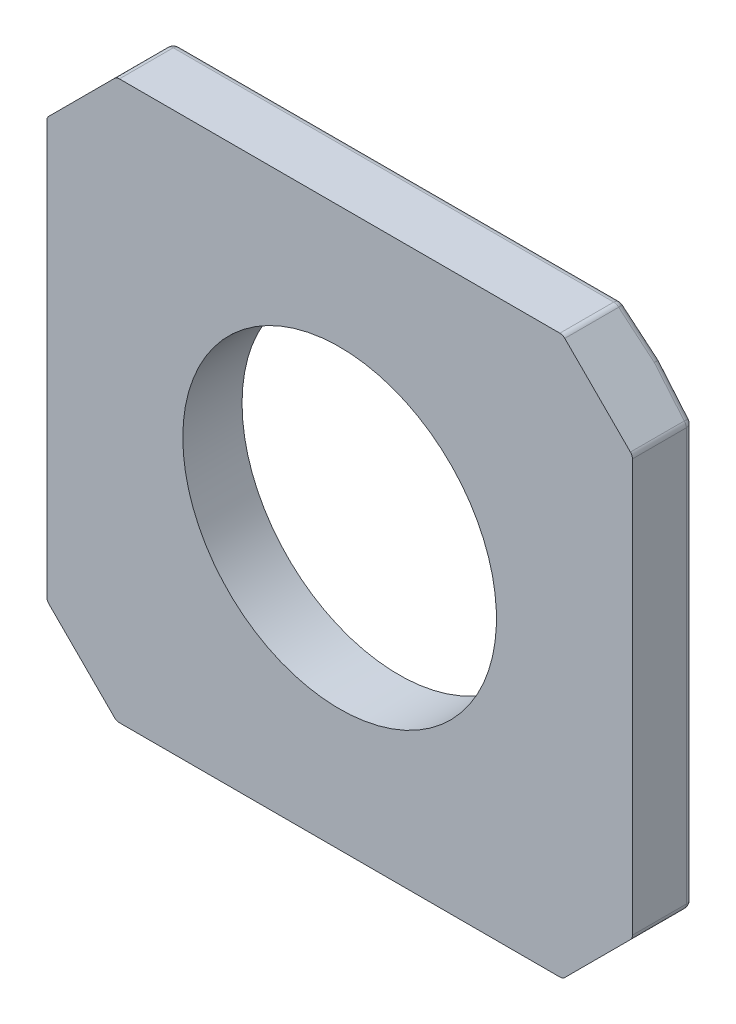
from build123d import *

# Parameters (mm, degrees)
SKETCH1_W             = 168.04206526
SKETCH1_H             = 160
BOSS_EXTRUDE1_DEPTH   = 3
SKETCH3_R             = 45
BOSS_EXTRUDE4_DEPTH   = 5
CHAMFER1_SIZE         = 2.712148569
CHAMFER1_SIZE_2       = 31
SKETCH4_R             = 1.7
SKETCH4_R_2           = 1.683576216
CUT_EXTRUDE1_DEPTH    = 52
BOSS_EXTRUDE5_START   = 30
SKETCH5_W             = 168.04206526
SKETCH5_H             = 160
SKETCH5_R             = 45
BOSS_EXTRUDE5_DEPTH   = 30
CHAMFER2_SIZE         = 20
FILLET1_R             = 2
BOSS_EXTRUDE6_DEPTH   = 2
SKETCH6_W             = 2.066213129
SKETCH6_H             = 1.103220701
BOSS_EXTRUDE6_2_DEPTH = 2
BOSS_EXTRUDE6_3_DEPTH = 2
BOSS_EXTRUDE6_4_DEPTH = 2
BOSS_EXTRUDE6_5_DEPTH = 2
BOSS_EXTRUDE6_6_DEPTH = 2
BODY_MOVE_COPY1_ANGLE = 90
SKETCH8_R             = 1.7
CUT_EXTRUDE2_DEPTH    = 6
CUT_EXTRUDE3_DEPTH    = 13


with BuildPart() as part:
    # Sketch1 → Boss-Extrude1 (new body)
    with BuildSketch(Plane.XY):
        Rectangle(SKETCH1_W, SKETCH1_H)
        with BuildLine():
            ThreePointArc((13.58448221, 59.23734015), (-30.3875, 52.632693915), (-58.093282528, 17.854163384))
            ThreePointArc((-58.093282528, 17.854163384), (-58.904146387, 16.297210956), (-60.216127019, 15.13088858))
            Line((-60.216127019, 15.13088858), (-64.649261274, 12.445040222))
            ThreePointArc((-64.649261274, 12.445040222), (-66.295367611, 10.852102238), (-67.087867714, 8.702902135))
            ThreePointArc((-67.087867714, 8.702902135), (-67.65, 0), (-67.087867714, -8.702902135))
            ThreePointArc((-67.087867714, -8.702902135), (-66.295367611, -10.852102238), (-64.649261274, -12.445040222))
            Line((-64.649261274, -12.445040222), (-60.216127019, -15.13088858))
            ThreePointArc((-60.216127019, -15.13088858), (-58.904146387, -16.297210956), (-58.093282528, -17.854163384))
            ThreePointArc((-58.093282528, -17.854163384), (-30.3875, -52.632693915), (13.58448221, -59.23734015))
            ThreePointArc((13.58448221, -59.23734015), (15.338274495, -59.161092638), (17.004329617, -59.714140006))
            Line((17.004329617, -59.714140006), (21.546909654, -62.21042271))
            ThreePointArc((21.546909654, -62.21042271), (23.749487583, -62.839523623), (26.006999521, -62.451248794))
            ThreePointArc((26.006999521, -62.451248794), (33.825, -58.586618566), (41.080868193, -53.748346658))
            ThreePointArc((41.080868193, -53.748346658), (42.545880028, -51.987421385), (43.10235162, -49.765382488))
            Line((43.10235162, -49.765382488), (43.211797402, -44.583251426))
            ThreePointArc((43.211797402, -44.583251426), (43.565871892, -42.863881682), (44.508800318, -41.383176766))
            ThreePointArc((44.508800318, -41.383176766), (60.775, 0), (44.508800318, 41.383176766))
            ThreePointArc((44.508800318, 41.383176766), (43.565871892, 42.863881682), (43.211797402, 44.583251426))
            Line((43.211797402, 44.583251426), (43.10235162, 49.765382488))
            ThreePointArc((43.10235162, 49.765382488), (42.545880028, 51.987421385), (41.080868193, 53.748346658))
            ThreePointArc((41.080868193, 53.748346658), (33.825, 58.586618566), (26.006999521, 62.451248794))
            ThreePointArc((26.006999521, 62.451248794), (23.749487583, 62.839523623), (21.546909654, 62.21042271))
            Line((21.546909654, 62.21042271), (17.004329617, 59.714140006))
            ThreePointArc((17.004329617, 59.714140006), (15.338274495, 59.161092638), (13.58448221, 59.23734015))
        make_face(mode=Mode.SUBTRACT)
    extrude(amount=-BOSS_EXTRUDE1_DEPTH)

    # Chamfer1
    # the kernel refuses this chamfer: 31, 2.712148569 mm, written as the material it takes off along each edge
    with BuildSketch(Plane(origin=(-164.609689105, 80, -3), x_dir=(0, 0.40120984275090354, 0.9159861691531129), z_dir=(1, 0, 0)), Plane(origin=(164.609689105, -80, -3), x_dir=(0, -0.40120984275090354, 0.9159861691531129), z_dir=(-1, 0, 0))) as chamfer1_piece_1:
        Polygon((CHAMFER1_SIZE * 0.915986169256, CHAMFER1_SIZE * 0.401209842796), (-CHAMFER1_SIZE_2 * 0.401209842751, CHAMFER1_SIZE_2 * 0.915986169153), (0, 0), align=None)
    extrude(amount=329.21937821, mode=Mode.SUBTRACT)
    with BuildSketch(Plane(origin=(84.02103263, 160.588656475, -3), x_dir=(0.40120984275090354, 0, 0.9159861691531129), z_dir=(0, -1, 0)), Plane(origin=(-84.02103263, -160.588656475, -3), x_dir=(-0.40120984275090354, 0, 0.9159861691531129), z_dir=(0, 1, 0))) as chamfer1_piece_2:
        Polygon((CHAMFER1_SIZE * 0.915986169256, CHAMFER1_SIZE * 0.401209842796), (-CHAMFER1_SIZE_2 * 0.401209842751, CHAMFER1_SIZE_2 * 0.915986169153), (0, 0), align=None)
    extrude(amount=321.17731295, mode=Mode.SUBTRACT)



with BuildPart() as body_2:
    # Sketch3 → Boss-Extrude4 (new body)
    with BuildSketch(Plane.XY):
        with BuildLine():
            ThreePointArc((-58.093282528, 17.854163384), (-30.3875, 52.632693915), (13.58448221, 59.23734015))
            ThreePointArc((13.58448221, 59.23734015), (15.338274495, 59.161092638), (17.004329617, 59.714140006))
            Line((17.004329617, 59.714140006), (21.546909654, 62.21042271))
            ThreePointArc((21.546909654, 62.21042271), (23.749487583, 62.839523623), (26.006999521, 62.451248794))
            ThreePointArc((26.006999521, 62.451248794), (33.825, 58.586618566), (41.080868193, 53.748346658))
            ThreePointArc((41.080868193, 53.748346658), (42.545880028, 51.987421385), (43.10235162, 49.765382488))
            Line((43.10235162, 49.765382488), (43.211797402, 44.583251426))
            ThreePointArc((43.211797402, 44.583251426), (43.565871892, 42.863881682), (44.508800318, 41.383176766))
            ThreePointArc((44.508800318, 41.383176766), (60.775, 0), (44.508800318, -41.383176766))
            ThreePointArc((44.508800318, -41.383176766), (43.565871892, -42.863881682), (43.211797402, -44.583251426))
            Line((43.211797402, -44.583251426), (43.10235162, -49.765382488))
            ThreePointArc((43.10235162, -49.765382488), (42.545880028, -51.987421385), (41.080868193, -53.748346658))
            ThreePointArc((41.080868193, -53.748346658), (33.825, -58.586618566), (26.006999521, -62.451248794))
            ThreePointArc((26.006999521, -62.451248794), (23.749487583, -62.839523623), (21.546909654, -62.21042271))
            Line((21.546909654, -62.21042271), (17.004329617, -59.714140006))
            ThreePointArc((17.004329617, -59.714140006), (15.338274495, -59.161092638), (13.58448221, -59.23734015))
            ThreePointArc((13.58448221, -59.23734015), (-30.3875, -52.632693915), (-58.093282528, -17.854163384))
            ThreePointArc((-58.093282528, -17.854163384), (-58.904146387, -16.297210956), (-60.216127019, -15.13088858))
            Line((-60.216127019, -15.13088858), (-64.649261274, -12.445040222))
            ThreePointArc((-64.649261274, -12.445040222), (-66.295367611, -10.852102238), (-67.087867714, -8.702902135))
            ThreePointArc((-67.087867714, -8.702902135), (-67.65, 0), (-67.087867714, 8.702902135))
            ThreePointArc((-67.087867714, 8.702902135), (-66.295367611, 10.852102238), (-64.649261274, 12.445040222))
            Line((-64.649261274, 12.445040222), (-60.216127019, 15.13088858))
            ThreePointArc((-60.216127019, 15.13088858), (-58.904146387, 16.297210956), (-58.093282528, 17.854163384))
        make_face()
        Circle(SKETCH3_R, mode=Mode.SUBTRACT)
    extrude(amount=BOSS_EXTRUDE4_DEPTH)

    # Sketch4 → Cut-Extrude1 (cut)
    with BuildSketch(Plane(origin=(0, 0, -4), x_dir=(-1, 0, 0), z_dir=(0, 0, -1))):
        with Locations(Location((42, 35, 0), (0, 0, 180))):
            Circle(SKETCH4_R)
        with Locations(Location((42, -35, 0), (0, 0, 180))):
            Circle(SKETCH4_R)
        with Locations(Location((-42, -35, 0), (0, 0, 180))):
            Circle(SKETCH4_R_2)
        with Locations(Location((-42, 35, 0), (0, 0, 180))):
            Circle(SKETCH4_R)
    extrude(amount=-CUT_EXTRUDE1_DEPTH, mode=Mode.SUBTRACT)


with BuildPart() as part_1:
    add(part.part)

    add(body_2.part)  # Boss-Extrude5 merges body 2
    # Sketch5 → Boss-Extrude5 (add)
    # profile 1 of 2: a face of its own
    with BuildSketch(Plane.XY.offset(BOSS_EXTRUDE5_START)):
        Rectangle(SKETCH5_W, SKETCH5_H)
        with BuildLine():
            ThreePointArc((-60.216127019, 15.13088858), (-58.904146387, 16.297210956), (-58.093282528, 17.854163384))
            ThreePointArc((-58.093282528, 17.854163384), (-30.3875, 52.632693915), (13.58448221, 59.23734015))
            ThreePointArc((13.58448221, 59.23734015), (15.338274495, 59.161092638), (17.004329617, 59.714140006))
            Line((17.004329617, 59.714140006), (21.546909654, 62.21042271))
            ThreePointArc((21.546909654, 62.21042271), (23.749487583, 62.839523623), (26.006999521, 62.451248794))
            ThreePointArc((26.006999521, 62.451248794), (33.825, 58.586618566), (41.080868193, 53.748346658))
            ThreePointArc((41.080868193, 53.748346658), (42.545880028, 51.987421385), (43.10235162, 49.765382488))
            Line((43.10235162, 49.765382488), (43.211797402, 44.583251426))
            ThreePointArc((43.211797402, 44.583251426), (43.565871892, 42.863881682), (44.508800318, 41.383176766))
            ThreePointArc((44.508800318, 41.383176766), (60.775, 0), (44.508800318, -41.383176766))
            ThreePointArc((44.508800318, -41.383176766), (43.565871892, -42.863881682), (43.211797402, -44.583251426))
            Line((43.211797402, -44.583251426), (43.10235162, -49.765382488))
            ThreePointArc((43.10235162, -49.765382488), (42.545880028, -51.987421385), (41.080868193, -53.748346658))
            ThreePointArc((41.080868193, -53.748346658), (33.825, -58.586618566), (26.006999521, -62.451248794))
            ThreePointArc((26.006999521, -62.451248794), (23.749487583, -62.839523623), (21.546909654, -62.21042271))
            Line((21.546909654, -62.21042271), (17.004329617, -59.714140006))
            ThreePointArc((17.004329617, -59.714140006), (15.338274495, -59.161092638), (13.58448221, -59.23734015))
            ThreePointArc((13.58448221, -59.23734015), (-30.3875, -52.632693915), (-58.093282528, -17.854163384))
            ThreePointArc((-58.093282528, -17.854163384), (-58.904146387, -16.297210956), (-60.216127019, -15.13088858))
            Line((-60.216127019, -15.13088858), (-64.649261274, -12.445040222))
            ThreePointArc((-64.649261274, -12.445040222), (-66.295367611, -10.852102238), (-67.087867714, -8.702902135))
            ThreePointArc((-67.087867714, -8.702902135), (-67.65, 0), (-67.087867714, 8.702902135))
            ThreePointArc((-67.087867714, 8.702902135), (-66.295367611, 10.852102238), (-64.649261274, 12.445040222))
            Line((-64.649261274, 12.445040222), (-60.216127019, 15.13088858))
        make_face(mode=Mode.SUBTRACT)
    # profile 2 of 2: a face of its own
    with BuildSketch(Plane.XY.offset(BOSS_EXTRUDE5_START)):
        with BuildLine():
            ThreePointArc((-58.093282528, 17.854163384), (-30.3875, 52.632693915), (13.58448221, 59.23734015))
            ThreePointArc((13.58448221, 59.23734015), (15.338274495, 59.161092638), (17.004329617, 59.714140006))
            Line((17.004329617, 59.714140006), (21.546909654, 62.21042271))
            ThreePointArc((21.546909654, 62.21042271), (23.749487583, 62.839523623), (26.006999521, 62.451248794))
            ThreePointArc((26.006999521, 62.451248794), (33.825, 58.586618566), (41.080868193, 53.748346658))
            ThreePointArc((41.080868193, 53.748346658), (42.545880028, 51.987421385), (43.10235162, 49.765382488))
            Line((43.10235162, 49.765382488), (43.211797402, 44.583251426))
            ThreePointArc((43.211797402, 44.583251426), (43.565871892, 42.863881682), (44.508800318, 41.383176766))
            ThreePointArc((44.508800318, 41.383176766), (60.775, 0), (44.508800318, -41.383176766))
            ThreePointArc((44.508800318, -41.383176766), (43.565871892, -42.863881682), (43.211797402, -44.583251426))
            Line((43.211797402, -44.583251426), (43.10235162, -49.765382488))
            ThreePointArc((43.10235162, -49.765382488), (42.545880028, -51.987421385), (41.080868193, -53.748346658))
            ThreePointArc((41.080868193, -53.748346658), (33.825, -58.586618566), (26.006999521, -62.451248794))
            ThreePointArc((26.006999521, -62.451248794), (23.749487583, -62.839523623), (21.546909654, -62.21042271))
            Line((21.546909654, -62.21042271), (17.004329617, -59.714140006))
            ThreePointArc((17.004329617, -59.714140006), (15.338274495, -59.161092638), (13.58448221, -59.23734015))
            ThreePointArc((13.58448221, -59.23734015), (-30.3875, -52.632693915), (-58.093282528, -17.854163384))
            ThreePointArc((-58.093282528, -17.854163384), (-58.904146387, -16.297210956), (-60.216127019, -15.13088858))
            Line((-60.216127019, -15.13088858), (-64.649261274, -12.445040222))
            ThreePointArc((-64.649261274, -12.445040222), (-66.295367611, -10.852102238), (-67.087867714, -8.702902135))
            ThreePointArc((-67.087867714, -8.702902135), (-67.65, 0), (-67.087867714, 8.702902135))
            ThreePointArc((-67.087867714, 8.702902135), (-66.295367611, 10.852102238), (-64.649261274, 12.445040222))
            Line((-64.649261274, 12.445040222), (-60.216127019, 15.13088858))
            ThreePointArc((-60.216127019, 15.13088858), (-58.904146387, 16.297210956), (-58.093282528, 17.854163384))
        make_face()
        Circle(SKETCH5_R, mode=Mode.SUBTRACT)
    extrude(amount=-BOSS_EXTRUDE5_DEPTH)

    # Chamfer2
    chamfer2_edges = [part_1.edges().sort_by_distance(p)[0] for p in [
        (84.02103263, 80, 14.856074285),
        (-84.02103263, 80, 14.856074285),
        (84.02103263, -80, 14.856074285),
        (-84.02103263, -80, 14.856074285),
    ]]
    chamfer(chamfer2_edges, length=CHAMFER2_SIZE)

    # Fillet1
    fillet1_edges = [part_1.edges().sort_by_distance(p)[0] for p in [
        (-84.02103263, 0, -0.287851431),
        (-84.02103263, 60, 14.856074285),
        (-84.02103263, -60, 14.856074285),
        (0, -80, -0.287851431),
        (64.02103263, -80, 14.856074285),
        (-64.02103263, -80, 14.856074285),
        (69.02103263, -75, -0.725294748),
        (-69.02103263, -75, -0.725294748),
        (-79.02103263, 65, -0.725294748),
        (-79.02103263, -65, -0.725294748),
        (0, 80, -0.287851431),
        (64.02103263, 80, 14.856074285),
        (-64.02103263, 80, 14.856074285),
        (69.02103263, 75, -0.725294748),
        (-69.02103263, 75, -0.725294748),
        (84.02103263, 0, -0.287851431),
        (84.02103263, 60, 14.856074285),
        (84.02103263, -60, 14.856074285),
        (79.02103263, 65, -0.725294748),
        (79.02103263, -65, -0.725294748),
    ]]
    fillet(fillet1_edges, radius=FILLET1_R)

    # Sketch8 → Cut-Extrude2 (cut)
    with BuildSketch(Plane(origin=(0, 0, 0), x_dir=(-1, 0, 0), z_dir=(0, 0, -1))):
        with Locations((42, -35)):
            Circle(SKETCH8_R)
        with Locations((42, 35)):
            Circle(SKETCH8_R)
        with Locations((-42, -35)):
            Circle(SKETCH8_R)
        with Locations((-42, 35)):
            Circle(SKETCH8_R)
    extrude(amount=-CUT_EXTRUDE2_DEPTH, mode=Mode.SUBTRACT)

    # 3DSketch1 → Cut-Extrude3 (cut)
    with BuildSketch(Plane(origin=(63.192605506, 80, 30), x_dir=(-0.6254946879411165, -0.7802284251150079, 0), z_dir=(0, 0, 1))):
        with BuildLine():
            Line((0, 0), (79.053278122, -98.609334145))
            ThreePointArc((79.053278122, -98.609334145), (79.650793735, -99.111269232), (80.394908422, -99.346337461))
            Line((80.394908422, -99.346337461), (106.862463614, -102.259730355))
            ThreePointArc((106.862463614, -102.259730355), (107.63989266, -102.192144717), (108.33227954, -101.832194513))
            Line((108.33227954, -101.832194513), (200.666965772, -27.809185492))
            ThreePointArc((200.666965772, -27.809185492), (201.168900859, -27.211669879), (201.403969087, -26.467555192))
            Line((201.403969087, -26.467555192), (204.317361981, 0))
            ThreePointArc((204.317361981, 0), (204.249776343, 0.777429046), (203.88982614, 1.469815926))
            Line((203.88982614, 1.469815926), (124.836548018, 100.079150071))
            ThreePointArc((124.836548018, 100.079150071), (124.239032405, 100.581085158), (123.494917718, 100.816153386))
            Line((123.494917718, 100.816153386), (97.027362526, 103.72954628))
            ThreePointArc((97.027362526, 103.72954628), (96.24993348, 103.661960642), (95.557546601, 103.302010439))
            Line((95.557546601, 103.302010439), (3.222860368, 29.279001418))
            ThreePointArc((3.222860368, 29.279001418), (2.720925281, 28.681485805), (2.485857053, 27.937371117))
            Line((2.485857053, 27.937371117), (-0.427535841, 1.469815926))
            ThreePointArc((-0.427535841, 1.469815926), (-0.359950203, 0.69238688), (0, 0))
        make_face()
    extrude(amount=-CUT_EXTRUDE3_DEPTH, mode=Mode.SUBTRACT)


with BuildPart() as body_2_2:
    # Sketch6 → Boss-Extrude6 (new body)
    with BuildSketch(Plane.ZY.offset(84.02103263)):
        Polygon((1.384531239, 1.899299129), (1.384531239, -0.001388638), (0.219652417, -0.001388638), (0.219652417, 3.966925894), (4.536745792, 3.966925894), (4.034059539, 3.379025473), (1.384531239, 3.379025473), (1.384531239, 2.487199549), (4.370960767, 2.487199549), (3.85704364, 1.899299129), align=None)
    extrude(amount=BOSS_EXTRUDE6_DEPTH)


with BuildPart() as body_3:
    # Sketch6 → Boss-Extrude6 2 (new body)
    with BuildSketch(Plane.ZY.offset(84.02103263)):
        Polygon((9.400585252, 3.966925894), (9.400585252, -0.018719199), (8.201953327, -0.018719199), (8.201953327, 1.682196581), (6.09007803, 1.682196581), (6.09007803, -0.018719199), (4.868615021, -0.018719199), (4.868615021, 3.966925894), align=None)
        with Locations((7.140307908, 2.827415123)):
            Rectangle(SKETCH6_W, SKETCH6_H, mode=Mode.SUBTRACT)
    extrude(amount=BOSS_EXTRUDE6_2_DEPTH)


with BuildPart() as body_4:
    # Sketch6 → Boss-Extrude6 3 (new body)
    with BuildSketch(Plane.ZY.offset(84.02103263)):
        Polygon((13.732454481, 0.596822542), (13.217639819, 0.00825764), (9.838151466, 0.00825764), (9.838151466, 4.00825764), (11.033266636, 4.00825764), (11.033266636, 0.596822542), align=None)
    extrude(amount=BOSS_EXTRUDE6_3_DEPTH)


with BuildPart() as body_5:
    # Sketch6 → Boss-Extrude6 4 (new body)
    with BuildSketch(Plane.ZY.offset(84.02103263)):
        Polygon((18.546658589, 0.596822542), (18.034438149, 0.00825764), (14.061108552, 0.00825764), (14.061108552, 4.00825764), (18.541066135, 4.00825764), (18.034438149, 3.419648385), (15.279292698, 3.419648385), (15.279292698, 0.596822542), align=None)
    extrude(amount=BOSS_EXTRUDE6_4_DEPTH)


with BuildPart() as body_6:
    # Sketch6 → Boss-Extrude6 5 (new body)
    with BuildSketch(Plane.ZY.offset(84.02103263)):
        Polygon((23.456651321, 0.003303056), (23.456651321, 4.013212224), (18.928161556, 4.013212224), (18.928161556, 1.09913704), (19.903417869, 0.003303056), align=None)
        Polygon((22.25764119, 3.438479675), (22.25764119, 0.578034799), (20.801406379, 0.578034799), (20.127171688, 1.359688161), (20.127171688, 3.438479675), align=None, mode=Mode.SUBTRACT)
    extrude(amount=BOSS_EXTRUDE6_5_DEPTH)


with BuildPart() as body_7:
    # Sketch6 → Boss-Extrude6 6 (new body)
    with BuildSketch(Plane.ZY.offset(84.02103263)):
        Polygon((28.376552415, 0.00825764), (25.128517788, 2.185376357), (25.128517788, 0.00825764), (23.94385208, 0.00825764), (23.94385208, 4.00825764), (27.208768098, 1.848237238), (27.208768098, 4.00825764), (28.376552415, 4.00825764), align=None)
    extrude(amount=BOSS_EXTRUDE6_6_DEPTH)


with BuildPart() as body_7_1:
    # Body-Move/Copy1: moved
    add(body_7.part.rotate(Axis((0, 1.998317089, 14.159099079), (-1, 0, 0)), BODY_MOVE_COPY1_ANGLE))


with BuildPart() as body_2_2_1:
    # Body-Move/Copy1: moved
    add(body_2_2.part.rotate(Axis((0, 1.998317089, 14.159099079), (-1, 0, 0)), BODY_MOVE_COPY1_ANGLE))


with BuildPart() as body_3_1:
    # Body-Move/Copy1: moved
    add(body_3.part.rotate(Axis((0, 1.998317089, 14.159099079), (-1, 0, 0)), BODY_MOVE_COPY1_ANGLE))


with BuildPart() as body_4_1:
    # Body-Move/Copy1: moved
    add(body_4.part.rotate(Axis((0, 1.998317089, 14.159099079), (-1, 0, 0)), BODY_MOVE_COPY1_ANGLE))


with BuildPart() as body_5_1:
    # Body-Move/Copy1: moved
    add(body_5.part.rotate(Axis((0, 1.998317089, 14.159099079), (-1, 0, 0)), BODY_MOVE_COPY1_ANGLE))


with BuildPart() as body_6_1:
    # Body-Move/Copy1: moved
    add(body_6.part.rotate(Axis((0, 1.998317089, 14.159099079), (-1, 0, 0)), BODY_MOVE_COPY1_ANGLE))


with BuildPart() as body_2_2_2:
    # Body-Move/Copy2: moved
    add(body_2_2_1.part.moved(Location((0, 0, -4.563904652))))


with BuildPart() as body_3_2:
    # Body-Move/Copy2: moved
    add(body_3_1.part.moved(Location((0, 0, -4.563904652))))


with BuildPart() as body_4_2:
    # Body-Move/Copy2: moved
    add(body_4_1.part.moved(Location((0, 0, -4.563904652))))


with BuildPart() as body_5_2:
    # Body-Move/Copy2: moved
    add(body_5_1.part.moved(Location((0, 0, -4.563904652))))


with BuildPart() as body_6_2:
    # Body-Move/Copy2: moved
    add(body_6_1.part.moved(Location((0, 0, -4.563904652))))


with BuildPart() as body_7_2:
    # Body-Move/Copy2: moved
    add(body_7_1.part.moved(Location((0, 0, -4.563904652))))


solid = Compound([part_1.part, body_2_2_2.part, body_3_2.part, body_4_2.part, body_5_2.part, body_6_2.part, body_7_2.part])
